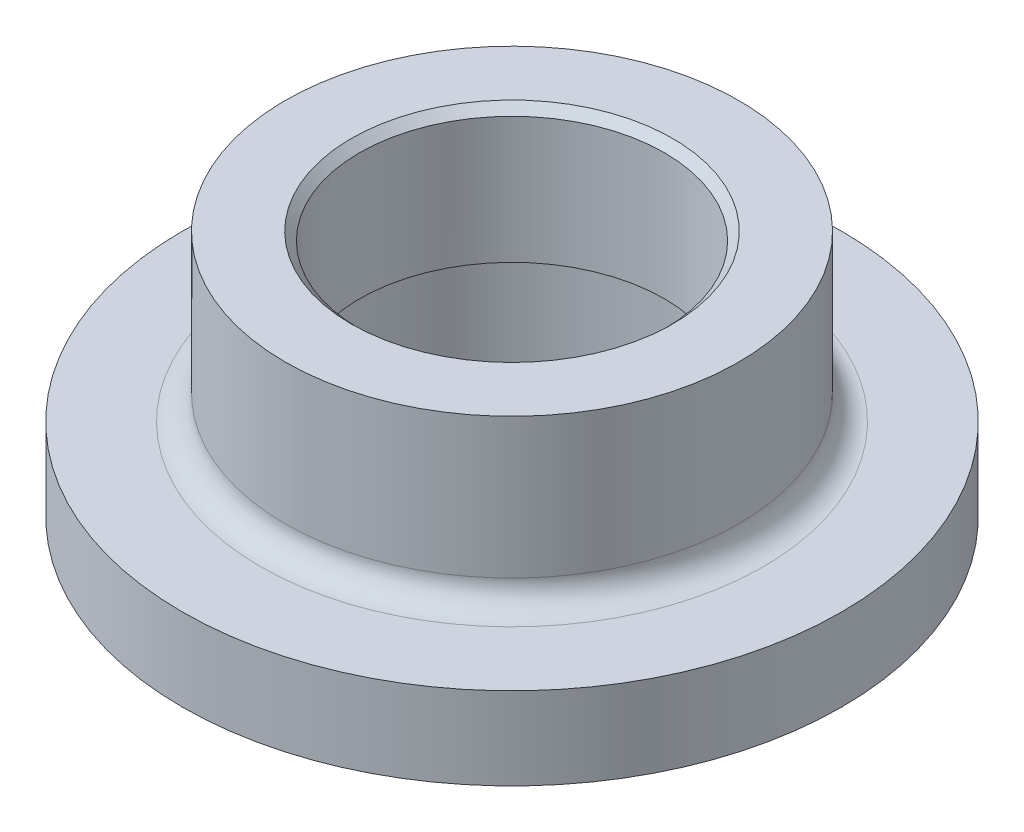
from build123d import *

# Parameters (mm, degrees)
SKETCH1_R           = 8
SKETCH1_R_2         = 3.7
BOSS_EXTRUDE1_DEPTH = 2
SKETCH2_R           = 5.5
SKETCH2_R_2         = 3.7
BOSS_EXTRUDE2_DEPTH = 4
FILLET2_R           = 0.6
CHAMFER2_SIZE       = 0.2
SKETCH3_R           = 4.1
CUT_EXTRUDE1_DEPTH  = 2.5
CHAMFER3_SIZE2      = 0.4
CHAMFER3_SIZE       = 0.230940108


with BuildPart() as part:
    # Sketch1 → Boss-Extrude1 (new body)
    with BuildSketch(Plane(origin=(0, 0, 0), x_dir=(1, 0, 0), z_dir=(0, 1, 0))):
        with Locations(Location((0, 0, 0), (0, 0, 270))):
            Circle(SKETCH1_R)
        with Locations(Location((0, 0, 0), (0, 0, 270))):
            Circle(SKETCH1_R_2, mode=Mode.SUBTRACT)
    extrude(amount=BOSS_EXTRUDE1_DEPTH)

    # Sketch2 → Boss-Extrude2 (add)
    with BuildSketch(Plane(origin=(0, 2, 0), x_dir=(1, 0, 0), z_dir=(0, 1, 0))):
        with Locations(Location((0, 0, 0), (0, 0, 270))):
            Circle(SKETCH2_R)
        with Locations(Location((0, 0, 0), (0, 0, 270))):
            Circle(SKETCH2_R_2, mode=Mode.SUBTRACT)
    extrude(amount=BOSS_EXTRUDE2_DEPTH)

    # Fillet2
    fillet2_edges = [part.edges().sort_by_distance(p)[0] for p in [
        (0, 2, -5.5),
    ]]
    fillet(fillet2_edges, radius=FILLET2_R)

    # Chamfer2
    chamfer2_edges = [part.edges().sort_by_distance(p)[0] for p in [
        (0, 6, -3.7),
    ]]
    chamfer(chamfer2_edges, length=CHAMFER2_SIZE)

    # Sketch3 → Cut-Extrude1 (cut)
    with BuildSketch(Plane.XZ):
        with Locations(Location((0, 0, 0), (0, 0, 270))):
            Circle(SKETCH3_R)
    extrude(amount=-CUT_EXTRUDE1_DEPTH, mode=Mode.SUBTRACT)

    # Chamfer3
    chamfer3_edges = [part.edges().sort_by_distance(p)[0] for p in [
        (0, 2.5, -3.7),
    ]]
    chamfer3_side = [part.faces().sort_by_distance(p)[0] for p in [
        (0, 2.504618802, -3.7),
    ]]
    chamfer(chamfer3_edges, length=CHAMFER3_SIZE - 0.0001, length2=CHAMFER3_SIZE2 - 0.0001, reference=chamfer3_side[0])  # a hair under: the kernel refuses the full size


solid = part.part
